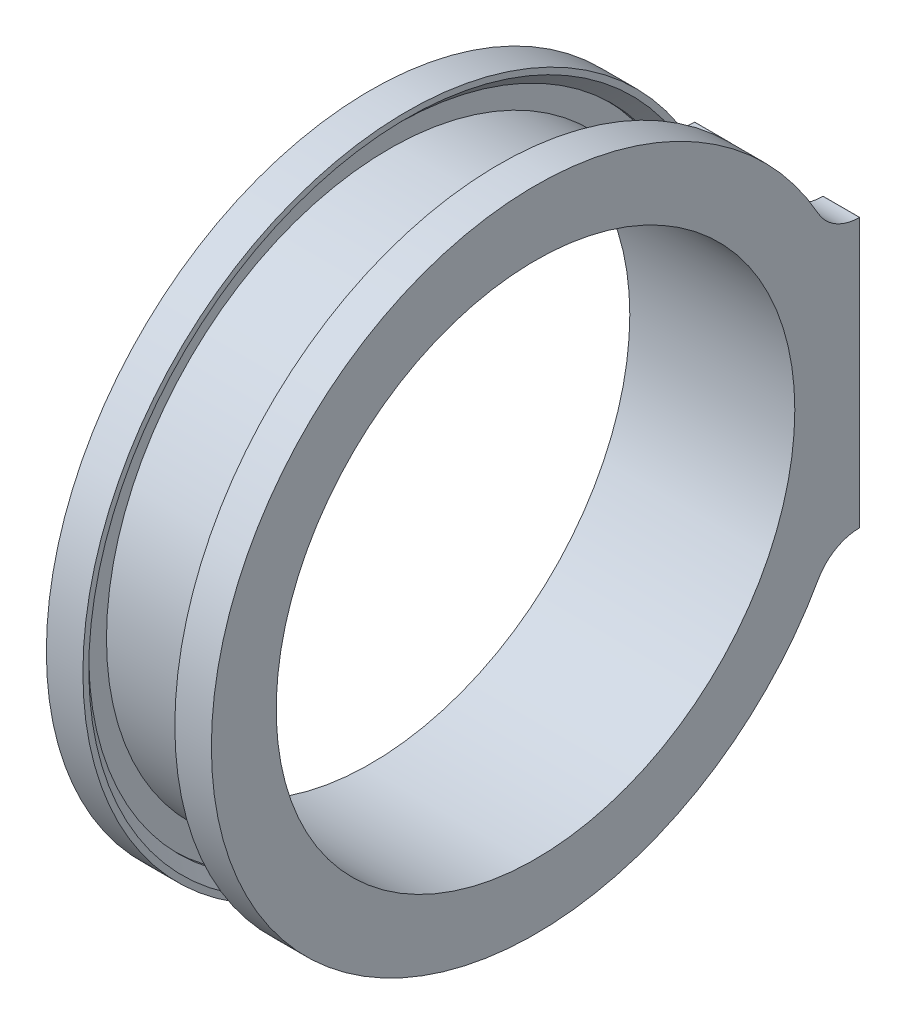
from build123d import *

# Parameters (mm, degrees)
SKETCH6_R                = 13.75
SKETCH6_R_2              = 11
BOSS_EXTRUDE2_DEPTH      = 7
SKETCH4_W                = 5.4
SKETCH4_H                = 1.75
BOSS_EXTRUDE3_REACH      = 30.322
SKETCH9_W                = 7
SKETCH9_H                = 9.16515139
BOSS_EXTRUDE4_START      = 0.75
SKETCH10_R               = 13.75
SKETCH10_R_2             = 13
BOSS_EXTRUDE4_DEPTH      = 0.75
CHAMFER1_SIZE            = 0.5
CHAMFER1_OF_MIRROR1_SIZE = 0.5
BOSS_EXTRUDE5_DEPTH      = 1.55
BOSS_EXTRUDE5_START      = 5.45
BOSS_EXTRUDE5_2_DEPTH    = 1.55
FILLET1_R                = 2
SKETCH12_W               = 1.554666846
SKETCH12_H               = 4.45309529
SKETCH12_W_2             = 1.373791393
SKETCH12_H_2             = 2.545281327
SKETCH12_W_3             = 0.712647602
SKETCH12_H_3             = 1.069707629
SKETCH12_W_4             = 1.072015963
SKETCH12_W_5             = 0.597408117
SKETCH12_H_4             = 1.399070537
SKETCH12_W_6             = 0.336309622
CUT_EXTRUDE1_DEPTH       = 1
SKETCH14_R               = 11
CUT_EXTRUDE2_DEPTH       = 21.667002685


# Read off the part's stored shape, not the designer's step: Boss-Extrude5
with BuildPart() as part:
    # Sketch6 → Boss-Extrude2 (new body)
    with BuildSketch(Plane(origin=(0, 0, 0), x_dir=(0, 0, -1), z_dir=(1, 0, 0))):
        Circle(SKETCH6_R)
        Circle(SKETCH6_R_2, mode=Mode.SUBTRACT)
    extrude(amount=BOSS_EXTRUDE2_DEPTH)

    # Sketch4 → Cut-Revolve1 (revolve, cut)
    with BuildSketch(Plane.XY, mode=Mode.PRIVATE) as cut_revolve1_sk:
        with Locations((3.5, -12.875)):
            Rectangle(SKETCH4_W, SKETCH4_H)
    revolve(cut_revolve1_sk.sketch.rotate(Axis((-11.602577702, 0, 0), (1, 0, 0)), 270), axis=Axis((-11.602577702, 0, 0), (1, 0, 0)), mode=Mode.SUBTRACT)

    # Sketch9 → Boss-Extrude3 (add, up to next)
    with BuildSketch(Plane.XY.offset(-10), mode=Mode.PRIVATE) as boss_extrude3_sk1:
        with Locations((3.5, 0)):
            Rectangle(SKETCH9_W, SKETCH9_H)
    boss_extrude3_tool1 = extrude(boss_extrude3_sk1.sketch, amount=-BOSS_EXTRUDE3_REACH, mode=Mode.PRIVATE) - part.part
    add(boss_extrude3_tool1.solids().sort_by_distance((3.5, 0, -10))[0])

    # Sketch10 → Boss-Extrude4 (add)
    with BuildSketch(Plane.ZY.offset(-6.2).offset(BOSS_EXTRUDE4_START)):
        Circle(SKETCH10_R)
        Circle(SKETCH10_R_2, mode=Mode.SUBTRACT)
    boss_extrude4 = extrude(amount=-BOSS_EXTRUDE4_DEPTH)

    # Chamfer1
    chamfer1_edges = [part.edges().sort_by_distance(p)[0] for p in [
        (5.45, 0, -13),
    ]]
    chamfer(chamfer1_edges, length=CHAMFER1_SIZE)

    # Mirror1: Boss-Extrude4 across plane
    add(boss_extrude4.mirror(Plane.ZY.offset(-3.5)))

    # Chamfer1 of Mirror1
    chamfer1_of_mirror1_edges = [part.edges().sort_by_distance(p)[0] for p in [
        (1.55, 0, -13),
    ]]
    chamfer(chamfer1_of_mirror1_edges, length=CHAMFER1_OF_MIRROR1_SIZE)

    # Boss-Extrude5 outline → Boss-Extrude5 (add)
    with BuildSketch(Plane.YZ):
        with BuildLine():
            ThreePointArc((0, -13.75), (-2.917586852, -13.436896478), (-5.7023, -12.511845376))
            Line((-5.7023, -12.511845376), (-5.7023, -13.75))
            Line((-5.7023, -13.75), (0, -13.75))
        make_face()
        with BuildLine():
            ThreePointArc((5.7023, -12.511845376), (2.917586852, -13.436896478), (0, -13.75))
            Line((0, -13.75), (5.7023, -13.75))
            Line((5.7023, -13.75), (5.7023, -12.511845376))
        make_face()
    extrude(amount=BOSS_EXTRUDE5_DEPTH)

    # Boss-Extrude5 2 outline → Boss-Extrude5 2 (add)
    with BuildSketch(Plane.YZ.offset(BOSS_EXTRUDE5_START)):
        with BuildLine():
            ThreePointArc((0, -13.75), (-2.917586852, -13.436896478), (-5.7023, -12.511845376))
            Line((-5.7023, -12.511845376), (-5.7023, -13.75))
            Line((-5.7023, -13.75), (0, -13.75))
        make_face()
        with BuildLine():
            ThreePointArc((5.7023, -12.511845376), (2.917586852, -13.436896478), (0, -13.75))
            Line((0, -13.75), (5.7023, -13.75))
            Line((5.7023, -13.75), (5.7023, -12.511845376))
        make_face()
    extrude(amount=BOSS_EXTRUDE5_2_DEPTH)

    # Fillet1
    fillet1_edges = [part.edges().sort_by_distance(p)[0] for p in [
        (6.225, -5.7023, -12.511845376),
        (6.225, 5.7023, -12.511845376),
        (0.775, -5.7023, -12.511845376),
        (0.775, 5.7023, -12.511845376),
    ]]
    fillet(fillet1_edges, radius=FILLET1_R)

    # Sketch12 → Cut-Extrude1 (cut)
    with BuildSketch(Plane(origin=(0, 0, -13.75), x_dir=(-1, 0, 0), z_dir=(0, 0, -1))):
        with Locations((-5.370167958, -3.135823217)):
            Rectangle(SKETCH12_W, SKETCH12_H)
        Polygon((-4.592834535, -0.909275572), (-4.592834535, -1.672246677), (-3.997102403, -1.672246677), (-3.997102403, -0.27317614), (-5.19036655, -0.27317614), (-5.19036655, -0.909275572), align=None)
        with Locations((-5.279730232, 1.561396449)):
            Rectangle(SKETCH12_W_2, SKETCH12_H_2)
        with Locations((-1.906323801, 0.675050165)):
            Rectangle(SKETCH12_W_3, SKETCH12_H_3)
        with Locations((-1.013992018, 0.675050165)):
            Rectangle(SKETCH12_W_4, SKETCH12_H_3)
        with Locations((-1.848704059, -0.972711409)):
            Rectangle(SKETCH12_W_5, SKETCH12_H_4)
        with Locations((-1.381845189, -0.972711409)):
            Rectangle(SKETCH12_W_6, SKETCH12_H_4)
    extrude(amount=-CUT_EXTRUDE1_DEPTH, mode=Mode.SUBTRACT)

    # Sketch14 → Cut-Extrude2 (cut, through all)
    with BuildSketch(Plane(origin=(7, 0, 0), x_dir=(0, 0, -1), z_dir=(1, 0, 0))):
        Circle(SKETCH14_R)
    extrude(amount=-CUT_EXTRUDE2_DEPTH, mode=Mode.SUBTRACT)


solid = part.part
